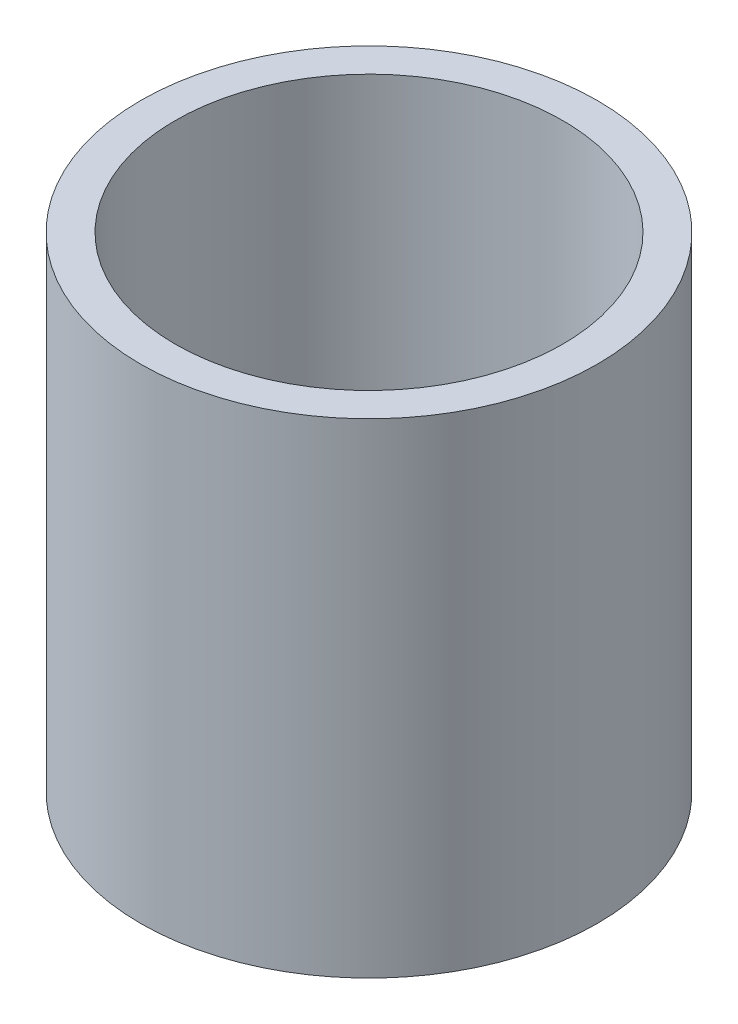
from build123d import *

# Parameters (mm, degrees)
SKETCH1_R               = 825
BOSS_EXTRUDE1_DEPTH     = 875
CUT_EXTRUDE1_DEPTH      = 1459.380951604
CUT_EXTRUDE1_DEPTH_BACK = 1459.380951604
SKETCH2_R               = 700


with BuildPart() as part:
    # Sketch1 → Boss-Extrude1 (new, symmetric)
    with BuildSketch(Plane(origin=(0, 0, 0), x_dir=(1, 0, 0), z_dir=(0, 1, 0))):
        Circle(SKETCH1_R)
    extrude(amount=BOSS_EXTRUDE1_DEPTH, both=True)

    # Sketch2 → Cut-Extrude1 (cut, two sides: drawn at the far end of the back side and taken through both)
    with BuildSketch(Plane(origin=(0, 0, 0), x_dir=(1, 0, 0), z_dir=(0, 1, 0)).offset(-CUT_EXTRUDE1_DEPTH_BACK)):
        Circle(SKETCH2_R)
    extrude(amount=CUT_EXTRUDE1_DEPTH + CUT_EXTRUDE1_DEPTH_BACK, mode=Mode.SUBTRACT)


solid = part.part
